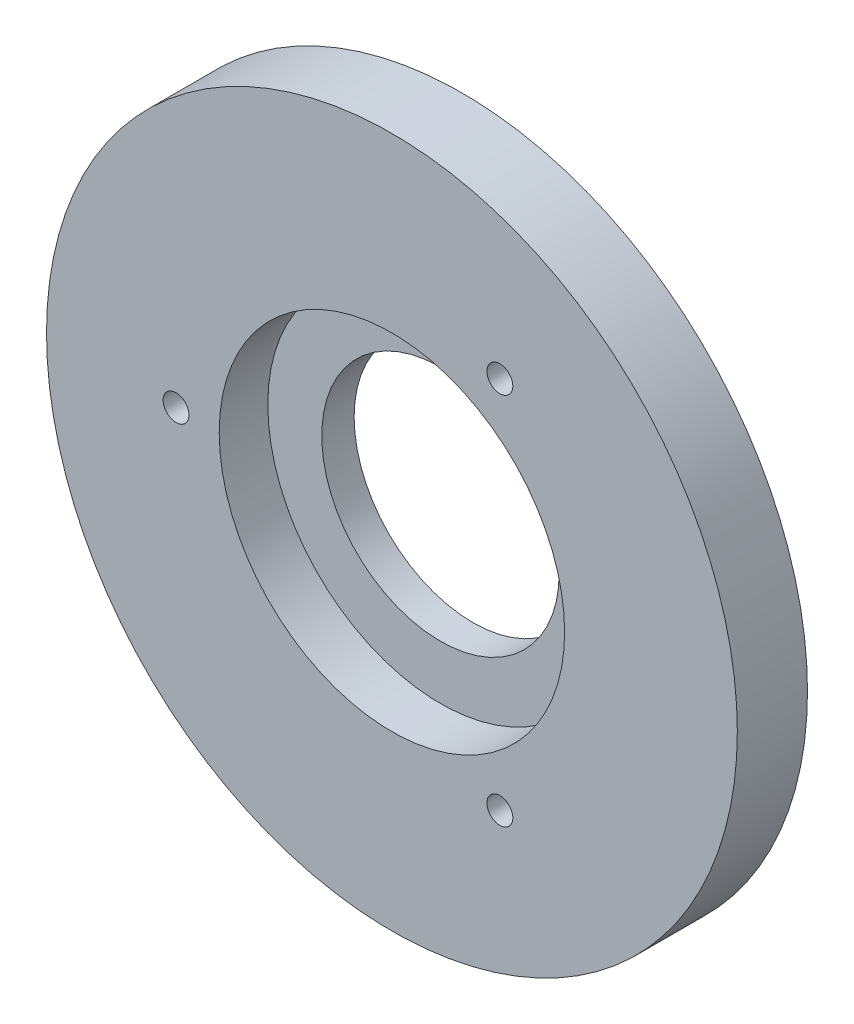
from build123d import *

# Parameters (mm, degrees)
SKETCH_1_R          = 16
EXTRUDE_1_DEPTH     = 9
SKETCH_2_R          = 6
EXTRUDE_2_DEPTH     = 0.5
SKETCH_3_R          = 16
EXTRUDE_3_DEPTH     = 3.25
SKETCH_4_R          = 5.5
EXTRUDE_4_DEPTH     = 2.25
SKETCH_5_R          = 3
CUT_EXTRUDE_1_DEPTH = 26.25
CUT_EXTRUDE_START   = -2.25
SKETCH_6_R          = 8
SKETCH_6_R_2        = 5.5
CUT_EXTRUDE_2_DEPTH = 2.25
SKETCH_7_R          = 0.6
CUT_EXTRUDE_3_DEPTH = 6
SKETCH_8_R          = 0.6
CUT_EXTRUDE_4_DEPTH = 3
SKETCH_9_R          = 28.808997231
CUT_EXTRUDE_5_DEPTH = 9
CUT_EXTRUDE_START_2 = -9
SKETCH_10_R         = 5.5
CUT_EXTRUDE_6_DEPTH = 9


with BuildPart() as part:
    # 草图1 → 凸台-拉伸1 (new body)
    with BuildSketch(Plane.XY):
        Circle(SKETCH_1_R)
    extrude(amount=EXTRUDE_1_DEPTH)

    # 草图2 → 凸台-拉伸2 (add)
    with BuildSketch(Plane.XY.offset(9)):
        Circle(SKETCH_2_R)
    extrude(amount=EXTRUDE_2_DEPTH)

    # 草图3 → 凸台-拉伸3 (add)
    with BuildSketch(Plane.XY.offset(9.5)):
        Circle(SKETCH_3_R)
    extrude(amount=EXTRUDE_3_DEPTH)

    # 草图4 → 凸台-拉伸4 (add)
    with BuildSketch(Plane.XY.offset(12.75)):
        Circle(SKETCH_4_R)
    extrude(amount=EXTRUDE_4_DEPTH)

    # 草图5 → 切除-拉伸1 (cut)
    with BuildSketch(Plane.XY.offset(15)):
        Circle(SKETCH_5_R)
    extrude(amount=-CUT_EXTRUDE_1_DEPTH, mode=Mode.SUBTRACT)

    # 草图6 → 切除-拉伸2 (cut)
    with BuildSketch(Plane.XY.offset(12.75).offset(CUT_EXTRUDE_START)):
        Circle(SKETCH_6_R)
        Circle(SKETCH_6_R_2, mode=Mode.SUBTRACT)
    extrude(amount=CUT_EXTRUDE_2_DEPTH, mode=Mode.SUBTRACT)

    # 草图7 → 切除-拉伸3 (cut)
    with BuildSketch(Plane(origin=(0, 0, 0), x_dir=(-1, 0, 0), z_dir=(0, 0, -1))):
        with Locations((8.660254038, 5)):
            Circle(SKETCH_7_R)
        with Locations((-8.660254038, 5)):
            Circle(SKETCH_7_R)
        with Locations((0, -10)):
            Circle(SKETCH_7_R)
    extrude(amount=-CUT_EXTRUDE_3_DEPTH, mode=Mode.SUBTRACT)

    # 草图8 → 切除-拉伸4 (cut)
    with BuildSketch(Plane.XY.offset(12.75)):
        with Locations((5, -8.660254038)):
            Circle(SKETCH_8_R)
        with Locations((5, 8.660254038)):
            Circle(SKETCH_8_R)
        with Locations((-10, 0)):
            Circle(SKETCH_8_R)
    extrude(amount=-CUT_EXTRUDE_4_DEPTH, mode=Mode.SUBTRACT)

    # 草图9 → 切除-拉伸5 (cut)
    with BuildSketch(Plane(origin=(0, 0, 0), x_dir=(-1, 0, 0), z_dir=(0, 0, -1))):
        Circle(SKETCH_9_R)
    extrude(amount=-CUT_EXTRUDE_5_DEPTH, mode=Mode.SUBTRACT)

    # 草图10 → 切除-拉伸6 (cut)
    with BuildSketch(Plane.XY.offset(15).offset(CUT_EXTRUDE_START_2)):
        Circle(SKETCH_10_R)
    extrude(amount=CUT_EXTRUDE_6_DEPTH, mode=Mode.SUBTRACT)


solid = part.part
